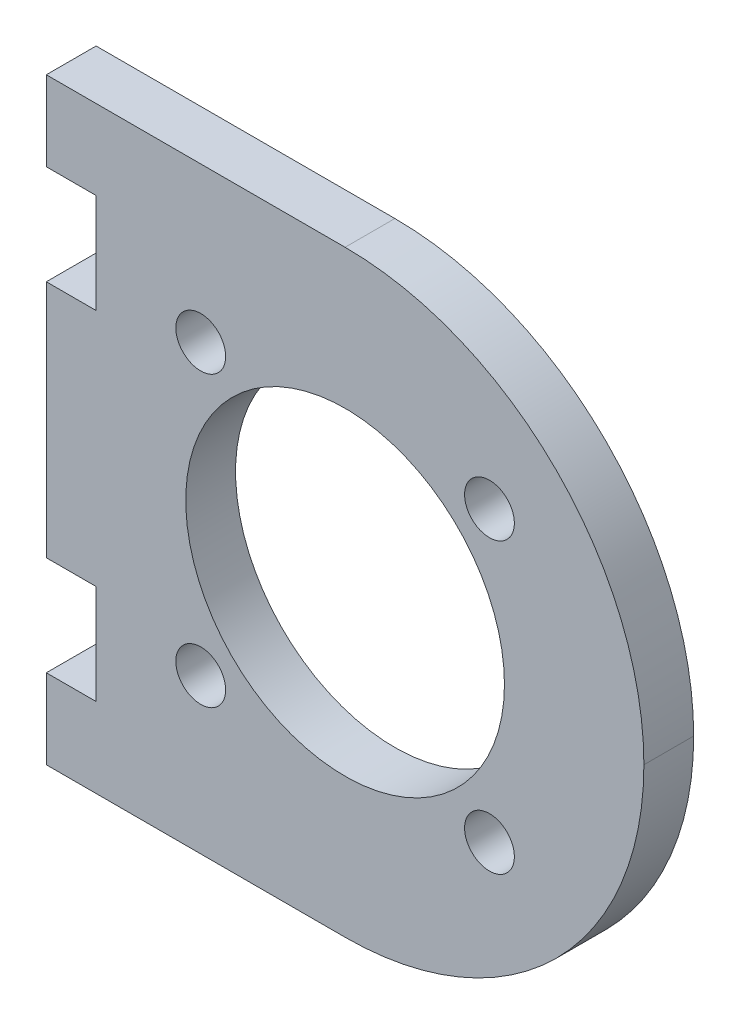
from build123d import *

# Parameters (mm, degrees)
SKETCH1_R           = 16
SKETCH1_R_2         = 2.5
BOSS_EXTRUDE1_DEPTH = 5
FILLET1_R           = 30


with BuildPart() as part:
    # Sketch1 → Boss-Extrude1 (new body)
    with BuildSketch(Plane(origin=(0, 0, 0), x_dir=(0, 1, 0), z_dir=(0, 0, 1))):
        Polygon((-30, -30), (30, -30), (30, 30), (22, 30), (22, 25), (12, 25), (12, 30), (-12, 30), (-12, 25), (-22, 25), (-22, 30), (-30, 30), align=None)
        with Locations(Location((0, 0, 0), (0, 0, 270))):
            Circle(SKETCH1_R, mode=Mode.SUBTRACT)
        with Locations(Location((14.495689014, 14.495689014, 0), (0, 0, 270))):
            Circle(SKETCH1_R_2, mode=Mode.SUBTRACT)
        with Locations(Location((14.495689014, -14.495689014, 0), (0, 0, 270))):
            Circle(SKETCH1_R_2, mode=Mode.SUBTRACT)
        with Locations(Location((-14.495689014, -14.495689014, 0), (0, 0, 270))):
            Circle(SKETCH1_R_2, mode=Mode.SUBTRACT)
        with Locations(Location((-14.495689014, 14.495689014, 0), (0, 0, 270))):
            Circle(SKETCH1_R_2, mode=Mode.SUBTRACT)
    extrude(amount=BOSS_EXTRUDE1_DEPTH)

    # Fillet1
    fillet1_edges = [part.edges().sort_by_distance(p)[0] for p in [
        (30, 30, 2.5),
        (30, -30, 2.5),
    ]]
    fillet(fillet1_edges, radius=FILLET1_R - 0.0001)  # a hair under: the kernel refuses the full size


solid = part.part
